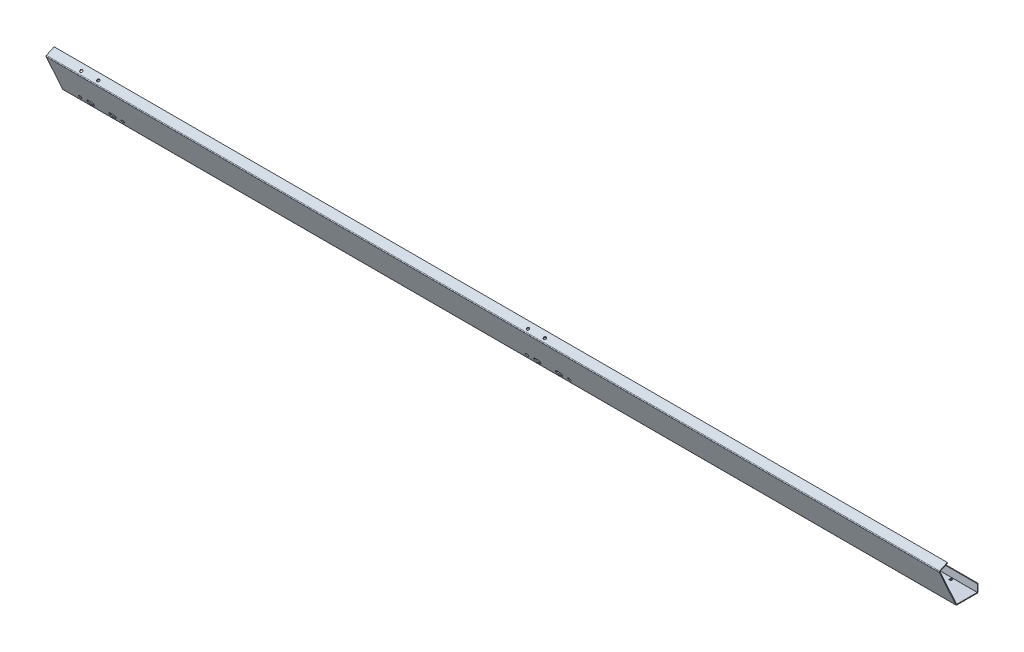
from build123d import *

# Parameters (mm, degrees)
SKETCH1_W                    = 4840
SKETCH1_H                    = 45
BASE_FLANGE1_DEPTH           = 4
EDGE_FLANGE1_STRIP_W         = 16.4
EDGE_FLANGE1_STRIP_H         = 4
EDGE_FLANGE1_STRIP_CUT_DEPTH = 4840
EDGE_FLANGE1_DEPTH           = 4840
EDGE_FLANGE2_START           = -2420
EDGE_FLANGE2_DEPTH           = 4840
EDGE_FLANGE2_2_DEPTH         = 4840
EDGE_FLANGE3_STRIP_W         = 16.4
EDGE_FLANGE3_STRIP_H         = 4
EDGE_FLANGE3_STRIP_CUT_DEPTH = 4840
EDGE_FLANGE3_DEPTH           = 4840
SKETCH15_R                   = 7
CUT_EXTRUDE1_DEPTH           = 10
SKETCH17_R                   = 6.5
CUT_EXTRUDE3_DEPTH           = 10
LPATTERN1_COUNT              = 27
LPATTERN1_PITCH              = 178
SKETCH18_R                   = 9
CUT_EXTRUDE4_DEPTH           = 10
LPATTERN2_COUNT              = 2
LPATTERN2_PITCH              = 2420
LPATTERN3_COUNT              = 2
LPATTERN3_PITCH              = 2420


# Read off the part's stored shape, not the designer's step: Edge-Flange2
# Sheet-metal steps are written as plain solids
with BuildPart() as part:
    # Sketch1 → Base-Flange1 (new body)
    with BuildSketch(Plane.XY):
        Rectangle(SKETCH1_W, SKETCH1_H)
    extrude(amount=-BASE_FLANGE1_DEPTH)

    # Edge-Flange1 strip (across the edge) → Edge-Flange1 strip cut (cut)
    with BuildSketch(Plane(origin=(-2420, -22.5, 0), x_dir=(0, 1, 0), z_dir=(1, 0, 0))):
        with Locations((-4, -2)):
            Rectangle(EDGE_FLANGE1_STRIP_W, EDGE_FLANGE1_STRIP_H)
    extrude(amount=EDGE_FLANGE1_STRIP_CUT_DEPTH, mode=Mode.SUBTRACT)

    # Edge-Flange1 section (across the edge) → Edge-Flange1 (add)
    with BuildSketch(Plane(origin=(-2420, -22.5, 0), x_dir=(0, 1, 0), z_dir=(1, 0, 0))):
        with BuildLine():
            Line((0, 0.2), (0, 116))
            Line((0, 116), (4, 116))
            Line((4, 116), (4, 0.2))
            ThreePointArc((4, 0.2), (4.058578644, 0.058578644), (4.2, 0))
            Line((4.2, 0), (4.2, -4))
            ThreePointArc((4.2, -4), (1.230151519, -2.769848481), (0, 0.2))
        make_face()
    extrude(amount=EDGE_FLANGE1_DEPTH)

    # Edge-Flange2 outline → Edge-Flange2 (cut)
    with BuildSketch(Plane.YZ.offset(EDGE_FLANGE2_START)):
        with BuildLine():
            ThreePointArc((-22.5, 111.475564199), (-21.832363854, 113.747656979), (-20.041711619, 115.297401537))
            Line((-20.041711619, 115.297401537), (-18.5, 116))
            Line((-18.5, 116), (-22.5, 116))
            Line((-22.5, 116), (-22.5, 111.475564199))
        make_face()
    extrude(amount=EDGE_FLANGE2_DEPTH, mode=Mode.SUBTRACT)

    # Edge-Flange2 2 outline → Edge-Flange2 2 (add)
    with BuildSketch(Plane.YZ.offset(EDGE_FLANGE2_START)):
        with BuildLine():
            Line((182.241285947, 207.483074576), (-18.5, 116))
            Line((-18.5, 116), (-18.5, 111.475564199))
            ThreePointArc((-18.5, 111.475564199), (-18.468207803, 111.583759093), (-18.382938649, 111.657556453))
            Line((-18.382938649, 111.657556453), (183.900058918, 203.843229492))
            Line((183.900058918, 203.843229492), (182.241285947, 207.483074576))
        make_face()
    extrude(amount=EDGE_FLANGE2_2_DEPTH)

    # Edge-Flange3 strip (across the edge) → Edge-Flange3 strip cut (cut)
    with BuildSketch(Plane(origin=(-2420, 183.900058918, 203.843229492), x_dir=(0, -0.9099612708765384, -0.41469324265624946), z_dir=(1, 0, 0))):
        with Locations((-4, -2)):
            Rectangle(EDGE_FLANGE3_STRIP_W, EDGE_FLANGE3_STRIP_H)
    extrude(amount=EDGE_FLANGE3_STRIP_CUT_DEPTH, mode=Mode.SUBTRACT)

    # Edge-Flange3 section (across the edge) → Edge-Flange3 (add)
    with BuildSketch(Plane(origin=(-2420, 183.900058918, 203.843229492), x_dir=(0, -0.9099612708765384, -0.41469324265624946), z_dir=(1, 0, 0))):
        with BuildLine():
            Line((0, 0.2), (0, 46))
            Line((0, 46), (4, 46))
            Line((4, 46), (4, 0.2))
            ThreePointArc((4, 0.2), (4.058578644, 0.058578644), (4.2, 0))
            Line((4.2, 0), (4.2, -4))
            ThreePointArc((4.2, -4), (1.230151519, -2.769848481), (0, 0.2))
        make_face()
    extrude(amount=EDGE_FLANGE3_DEPTH)

    # Sketch15 → Cut-Extrude1 (cut)
    with BuildSketch(Plane(origin=(0, 229.195895582, 104.450587277), x_dir=(1, 0, 0), z_dir=(0, 0.9099612708765382, 0.4146932426562498))):
        with Locations(Location((175, -93.227332411, 0), (0, 0, 270))):
            Circle(SKETCH15_R)
        with Locations(Location((265, -91.902677897, 0), (0, 0, 270))):
            Circle(SKETCH15_R)
    cut_extrude1 = extrude(amount=-CUT_EXTRUDE1_DEPTH, mode=Mode.SUBTRACT)

    # Sketch17 → Cut-Extrude3 (cut)
    with BuildSketch(Plane.XZ.offset(22.5)):
        with Locations(Location((2288, 11, 0), (0, 0, 270))):
            Circle(SKETCH17_R)
    cut_extrude3 = extrude(amount=-CUT_EXTRUDE3_DEPTH, mode=Mode.SUBTRACT)

    # LPattern1: Cut-Extrude3 ×27
    with Locations(*[(-i * LPATTERN1_PITCH, 0, 0) for i in range(1, LPATTERN1_COUNT)]):
        add(cut_extrude3, mode=Mode.SUBTRACT)

    # Sketch18 → Cut-Extrude4 (cut)
    with BuildSketch(Plane(origin=(0, -46.954609635, 103.032487299), x_dir=(1, 0, 0), z_dir=(0, -0.4146932426562464, 0.90996127087654))):
        with Locations(Location((335, 52.664953269, 0), (0, 0, 270))):
            Circle(SKETCH18_R)
        with Locations(Location((105, 52.664953269, 0), (0, 0, 270))):
            Circle(SKETCH18_R)
        with BuildLine():
            Line((168, 40.664953269), (154, 40.664953269))
            ThreePointArc((154, 40.664953269), (142, 52.664953269), (154, 64.664953269))
            Line((154, 64.664953269), (168, 64.664953269))
            ThreePointArc((168, 64.664953269), (180, 52.664953269), (168, 40.664953269))
        make_face()
        with BuildLine():
            Line((272, 64.664953269), (286, 64.664953269))
            ThreePointArc((286, 64.664953269), (298, 52.664953269), (286, 40.664953269))
            Line((286, 40.664953269), (272, 40.664953269))
            ThreePointArc((272, 40.664953269), (260, 52.664953269), (272, 64.664953269))
        make_face()
    cut_extrude4 = extrude(amount=-CUT_EXTRUDE4_DEPTH, mode=Mode.SUBTRACT)

    # LPattern2: Cut-Extrude1 ×2
    with Locations(*[(-i * LPATTERN2_PITCH, 0, 0) for i in range(1, LPATTERN2_COUNT)]):
        add(cut_extrude1, mode=Mode.SUBTRACT)

    # LPattern3: Cut-Extrude4 ×2
    with Locations(*[(-i * LPATTERN3_PITCH, 0, 0) for i in range(1, LPATTERN3_COUNT)]):
        add(cut_extrude4, mode=Mode.SUBTRACT)


solid = part.part
